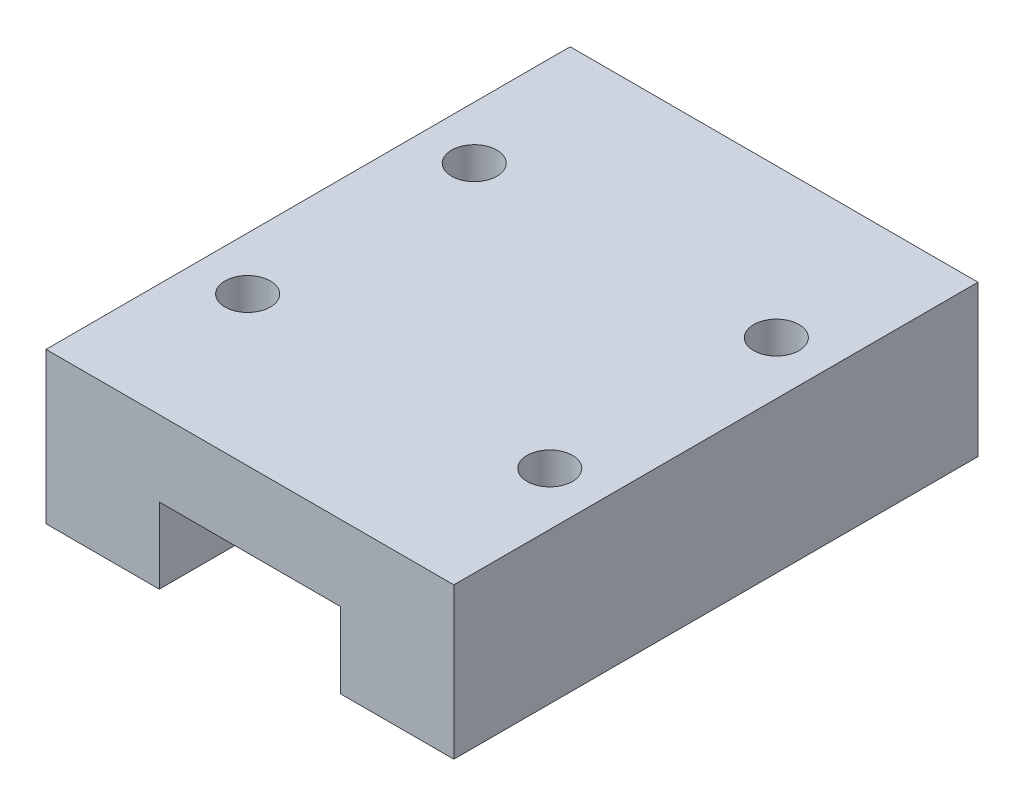
from build123d import *

# Parameters (mm, degrees)
EXTRUDE_1_DEPTH     = 34.7
SKETCH_3_R          = 1.5
CUT_EXTRUDE_1_DEPTH = 3.5


with BuildPart() as part:
    # 草图2 → 凸台-拉伸1 (new body)
    with BuildSketch(Plane.XY):
        Polygon((6, -5), (13.5, -5), (13.5, 5), (-13.5, 5), (-13.5, -5), (-6, -5), (-6, 0), (6, 0), align=None)
    extrude(amount=EXTRUDE_1_DEPTH)

    # 草图3 → 切除-拉伸1 (cut)
    with BuildSketch(Plane(origin=(0, 5, 0), x_dir=(1, 0, 0), z_dir=(0, 1, 0))):
        with Locations((-10, -9.85)):
            Circle(SKETCH_3_R)
        with Locations((10, -9.85)):
            Circle(SKETCH_3_R)
        with Locations((10, -24.85)):
            Circle(SKETCH_3_R)
        with Locations((-10, -24.85)):
            Circle(SKETCH_3_R)
    extrude(amount=-CUT_EXTRUDE_1_DEPTH, mode=Mode.SUBTRACT)


solid = part.part
